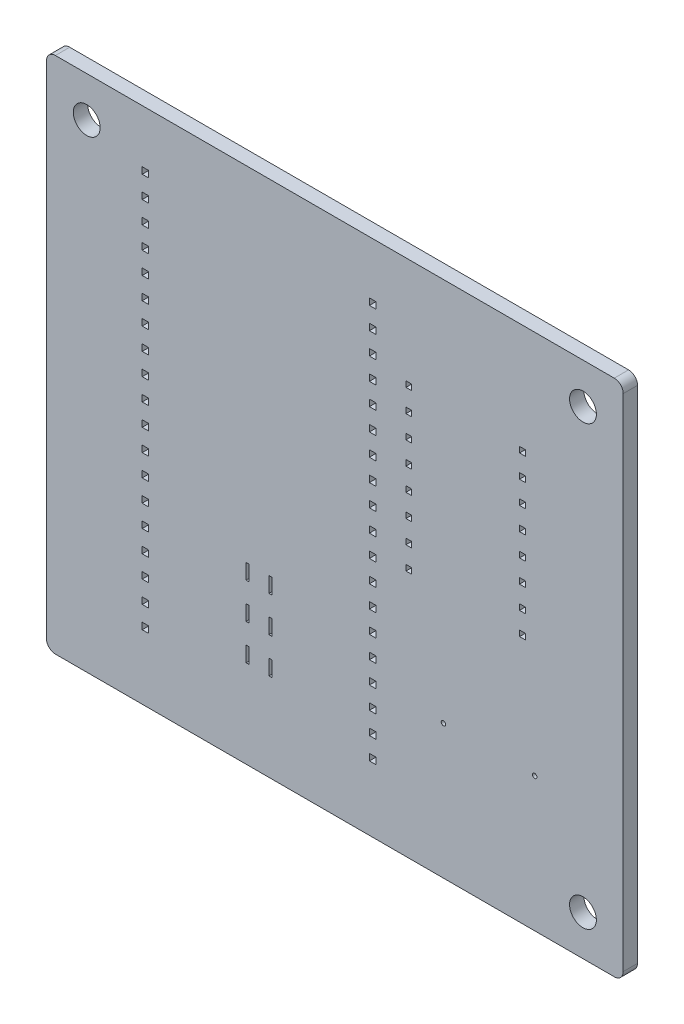
from build123d import *

# Parameters (mm, degrees)
SKETCH1_W            = 64.479999999
SKETCH1_H            = 57.961153769
SKETCH1_R            = 1.5
BOSS_EXTRUDE1_DEPTH  = 1.6
CAVITY1_START        = -42.506514758
CAVITY1_OUTLINE_W    = 0.72999995
CAVITY1_OUTLINE_H    = 1.6
CAVITY1_DEPTH        = 0.729999998
CAVITY1_START_2      = -17.106514758
CAVITY1_2_OUTLINE_W  = 0.72999995
CAVITY1_2_OUTLINE_H  = 1.6
CAVITY1_2_DEPTH      = 0.729999998
CAVITY1_START_3      = -13.02
CAVITY1_3_OUTLINE_W  = 0.64
CAVITY1_3_OUTLINE_H  = 1.6
CAVITY1_3_DEPTH      = 0.64
CAVITY1_START_4      = -0.32
CAVITY1_4_OUTLINE_W  = 0.64
CAVITY1_4_OUTLINE_H  = 1.6
CAVITY1_4_DEPTH      = 0.64
CAVITY1_START_5      = -30.889999853
CAVITY1_5_DEPTH      = 0.35
CAVITY1_START_6      = -28.339999853
CAVITY1_6_DEPTH      = 0.35
CAVITY1_START_7      = 6.554528938
CAVITY1_7_DEPTH      = 1.05
CAVITY1_START_8      = 18.954528938
CAVITY1_8_DEPTH      = 1.05
CAVITY1_START_9      = 7.604528938
CAVITY1_9_OUTLINE_W  = 0.4
CAVITY1_9_OUTLINE_H  = 0.05
CAVITY1_9_DEPTH      = 1
CAVITY1_START_10     = 17.954528938
CAVITY1_10_OUTLINE_W = 0.4
CAVITY1_10_OUTLINE_H = 0.05
CAVITY1_10_DEPTH     = 1
CAVITY1_11_OUTLINE_R = 0.25
CAVITY1_11_DEPTH     = 1.6
FILLET1_R            = 1


# Read off the part's stored shape, not the designer's step: Cavity1
with BuildPart() as part:
    # Sketch1 → Boss-Extrude1 (new body)
    with BuildSketch(Plane.XY):
        with Locations((-20.97, 1.019423116)):
            Rectangle(SKETCH1_W, SKETCH1_H)
        with Locations((-48.709999999, 25.5)):
            Circle(SKETCH1_R, mode=Mode.SUBTRACT)
        with Locations((6.77, 25.5)):
            Circle(SKETCH1_R, mode=Mode.SUBTRACT)
        with Locations((6.77, -23.461153769)):
            Circle(SKETCH1_R, mode=Mode.SUBTRACT)
    extrude(amount=BOSS_EXTRUDE1_DEPTH)

    # Cavity1 outline → Cavity1 (cut)
    with BuildSketch(Plane.YZ.offset(CAVITY1_START)):
        Polygon((2.032070031, 1.6), (1.302070031, 1.6), (1.302069981, 0), (2.032070031, 0), align=None)
        Polygon((-0.417930019, 0), (-0.417930019, 1.6), (-1.147929969, 1.6), (-1.147930019, 0), align=None)
        Polygon((-2.867930019, 0), (-2.867930019, 1.6), (-3.597929969, 1.6), (-3.597930019, 0), align=None)
        Polygon((4.482070031, 1.6), (3.752070031, 1.6), (3.752069981, 0), (4.482070031, 0), align=None)
        Polygon((-5.317930019, 0), (-5.317930019, 1.6), (-6.047929969, 1.6), (-6.047930019, 0), align=None)
        Polygon((-7.767930019, 0), (-7.767930019, 1.6), (-8.497929969, 1.6), (-8.497930019, 0), align=None)
        Polygon((6.932070031, 1.6), (6.202070031, 1.6), (6.202069981, 0), (6.932070031, 0), align=None)
        Polygon((-10.217929969, 0), (-10.217929969, 1.6), (-10.947929969, 1.6), (-10.947930019, 0), align=None)
        Polygon((9.382070031, 1.6), (8.652070031, 1.6), (8.652069981, 0), (9.382070031, 0), align=None)
        Polygon((-12.667930019, 0), (-12.667930019, 1.6), (-13.397929969, 1.6), (-13.397930019, 0), align=None)
        Polygon((11.832070031, 1.6), (11.102070031, 1.6), (11.102069981, 0), (11.832070031, 0), align=None)
        Polygon((-15.117930019, 0), (-15.117930019, 1.6), (-15.847929969, 1.6), (-15.847930019, 0), align=None)
        with Locations((-17.932929994, 0.8)):
            Rectangle(CAVITY1_OUTLINE_W, CAVITY1_OUTLINE_H)
        Polygon((14.282070031, 1.6), (13.552070031, 1.6), (13.552069981, 0), (14.282070031, 0), align=None)
        Polygon((-20.017930019, 0), (-20.017930019, 1.6), (-20.747929969, 1.6), (-20.747930019, 0), align=None)
        Polygon((16.732070031, 1.6), (16.002070031, 1.6), (16.002069981, 0), (16.732070031, 0), align=None)
        Polygon((19.182070031, 1.6), (18.452070031, 1.6), (18.452069981, 0), (19.182070031, 0), align=None)
        Polygon((21.632070031, 1.6), (20.902070031, 1.6), (20.902069981, 0), (21.632070031, 0), align=None)
        Polygon((24.082070031, 1.6), (23.352070031, 1.6), (23.352069981, 0), (24.082070031, 0), align=None)
    extrude(amount=CAVITY1_DEPTH, mode=Mode.SUBTRACT)

    # Cavity1 2 outline → Cavity1 2 (cut)
    with BuildSketch(Plane.YZ.offset(CAVITY1_START_2)):
        Polygon((2.032070031, 1.6), (1.302070031, 1.6), (1.302069981, 0), (2.032070031, 0), align=None)
        Polygon((-0.417930019, 0), (-0.417930019, 1.6), (-1.147929969, 1.6), (-1.147930019, 0), align=None)
        Polygon((-2.867930019, 0), (-2.867930019, 1.6), (-3.597929969, 1.6), (-3.597930019, 0), align=None)
        Polygon((4.482070031, 1.6), (3.752070031, 1.6), (3.752069981, 0), (4.482070031, 0), align=None)
        Polygon((-5.317930019, 0), (-5.317930019, 1.6), (-6.047929969, 1.6), (-6.047930019, 0), align=None)
        Polygon((-7.767930019, 0), (-7.767930019, 1.6), (-8.497929969, 1.6), (-8.497930019, 0), align=None)
        Polygon((6.932070031, 1.6), (6.202070031, 1.6), (6.202069981, 0), (6.932070031, 0), align=None)
        Polygon((-10.217929969, 0), (-10.217929969, 1.6), (-10.947929969, 1.6), (-10.947930019, 0), align=None)
        Polygon((9.382070031, 1.6), (8.652070031, 1.6), (8.652069981, 0), (9.382070031, 0), align=None)
        Polygon((-12.667930019, 0), (-12.667930019, 1.6), (-13.397929969, 1.6), (-13.397930019, 0), align=None)
        Polygon((11.832070031, 1.6), (11.102070031, 1.6), (11.102069981, 0), (11.832070031, 0), align=None)
        Polygon((-15.117930019, 0), (-15.117930019, 1.6), (-15.847929969, 1.6), (-15.847930019, 0), align=None)
        with Locations((-17.932929994, 0.8)):
            Rectangle(CAVITY1_2_OUTLINE_W, CAVITY1_2_OUTLINE_H)
        Polygon((14.282070031, 1.6), (13.552070031, 1.6), (13.552069981, 0), (14.282070031, 0), align=None)
        Polygon((-20.017930019, 0), (-20.017930019, 1.6), (-20.747929969, 1.6), (-20.747930019, 0), align=None)
        Polygon((16.732070031, 1.6), (16.002070031, 1.6), (16.002069981, 0), (16.732070031, 0), align=None)
        Polygon((19.182070031, 1.6), (18.452070031, 1.6), (18.452069981, 0), (19.182070031, 0), align=None)
        Polygon((21.632070031, 1.6), (20.902070031, 1.6), (20.902069981, 0), (21.632070031, 0), align=None)
        Polygon((24.082070031, 1.6), (23.352070031, 1.6), (23.352069981, 0), (24.082070031, 0), align=None)
    extrude(amount=CAVITY1_2_DEPTH, mode=Mode.SUBTRACT)

    # Cavity1 3 outline → Cavity1 3 (cut)
    with BuildSketch(Plane.YZ.offset(CAVITY1_START_3)):
        with Locations((0, 0.8)):
            Rectangle(CAVITY1_3_OUTLINE_W, CAVITY1_3_OUTLINE_H)
        with Locations((2.54, 0.8)):
            Rectangle(CAVITY1_3_OUTLINE_W, CAVITY1_3_OUTLINE_H)
        with Locations((5.08, 0.8)):
            Rectangle(CAVITY1_3_OUTLINE_W, CAVITY1_3_OUTLINE_H)
        with Locations((7.62, 0.8)):
            Rectangle(CAVITY1_3_OUTLINE_W, CAVITY1_3_OUTLINE_H)
        with Locations((10.16, 0.8)):
            Rectangle(CAVITY1_3_OUTLINE_W, CAVITY1_3_OUTLINE_H)
        with Locations((12.7, 0.8)):
            Rectangle(CAVITY1_3_OUTLINE_W, CAVITY1_3_OUTLINE_H)
        with Locations((15.24, 0.8)):
            Rectangle(CAVITY1_3_OUTLINE_W, CAVITY1_3_OUTLINE_H)
        with Locations((17.78, 0.8)):
            Rectangle(CAVITY1_3_OUTLINE_W, CAVITY1_3_OUTLINE_H)
    extrude(amount=CAVITY1_3_DEPTH, mode=Mode.SUBTRACT)

    # Cavity1 4 outline → Cavity1 4 (cut)
    with BuildSketch(Plane.YZ.offset(CAVITY1_START_4)):
        with Locations((0, 0.8)):
            Rectangle(CAVITY1_4_OUTLINE_W, CAVITY1_4_OUTLINE_H)
        with Locations((2.54, 0.8)):
            Rectangle(CAVITY1_4_OUTLINE_W, CAVITY1_4_OUTLINE_H)
        with Locations((5.08, 0.8)):
            Rectangle(CAVITY1_4_OUTLINE_W, CAVITY1_4_OUTLINE_H)
        with Locations((7.62, 0.8)):
            Rectangle(CAVITY1_4_OUTLINE_W, CAVITY1_4_OUTLINE_H)
        with Locations((10.16, 0.8)):
            Rectangle(CAVITY1_4_OUTLINE_W, CAVITY1_4_OUTLINE_H)
        with Locations((12.7, 0.8)):
            Rectangle(CAVITY1_4_OUTLINE_W, CAVITY1_4_OUTLINE_H)
        with Locations((15.24, 0.8)):
            Rectangle(CAVITY1_4_OUTLINE_W, CAVITY1_4_OUTLINE_H)
        with Locations((17.78, 0.8)):
            Rectangle(CAVITY1_4_OUTLINE_W, CAVITY1_4_OUTLINE_H)
    extrude(amount=CAVITY1_4_DEPTH, mode=Mode.SUBTRACT)

    # Cavity1 5 outline → Cavity1 5 (cut)
    with BuildSketch(Plane.YZ.offset(CAVITY1_START_5)):
        with BuildLine():
            Line((-8.419529048, 0.84979992), (-8.419529049, 1.6))
            Line((-8.419529049, 1.6), (-10.139529054, 1.6))
            Line((-10.139529054, 1.6), (-10.13952905, 0.84979992))
            ThreePointArc((-10.13952905, 0.84979992), (-10.171584104, 0.727325431), (-10.259529054, 0.636258353))
            ThreePointArc((-10.259529054, 0.636258353), (-10.347473997, 0.545191277), (-10.37952905, 0.42271679))
            Line((-10.37952905, 0.42271679), (-10.379529049, 0))
            Line((-10.379529049, 0), (-8.179529054, 0))
            Line((-8.179529054, 0), (-8.17952905, 0.42271679))
            ThreePointArc((-8.17952905, 0.42271679), (-8.211584103, 0.545191277), (-8.29952905, 0.636258355))
            ThreePointArc((-8.29952905, 0.636258355), (-8.387473996, 0.727325433), (-8.419529048, 0.84979992))
        make_face()
        with BuildLine():
            Line((-12.419529048, 0.84979992), (-12.419529049, 1.6))
            Line((-12.419529049, 1.6), (-14.139529054, 1.6))
            Line((-14.139529054, 1.6), (-14.13952905, 0.84979992))
            ThreePointArc((-14.13952905, 0.84979992), (-14.171584103, 0.727325433), (-14.25952905, 0.636258355))
            ThreePointArc((-14.25952905, 0.636258355), (-14.347473997, 0.545191277), (-14.37952905, 0.42271679))
            Line((-14.37952905, 0.42271679), (-14.379529049, 0))
            Line((-14.379529049, 0), (-12.179529054, 0))
            Line((-12.179529054, 0), (-12.17952905, 0.42271679))
            ThreePointArc((-12.17952905, 0.42271679), (-12.211584103, 0.545191277), (-12.29952905, 0.636258355))
            ThreePointArc((-12.29952905, 0.636258355), (-12.387473996, 0.727325433), (-12.419529048, 0.84979992))
        make_face()
        with BuildLine():
            Line((-16.419529048, 0.84979992), (-16.419529049, 1.6))
            Line((-16.419529049, 1.6), (-18.139529054, 1.6))
            Line((-18.139529054, 1.6), (-18.13952905, 0.84979992))
            ThreePointArc((-18.13952905, 0.84979992), (-18.171584103, 0.727325433), (-18.25952905, 0.636258355))
            ThreePointArc((-18.25952905, 0.636258355), (-18.347473998, 0.545191275), (-18.37952905, 0.42271679))
            Line((-18.37952905, 0.42271679), (-18.379529049, 0))
            Line((-18.379529049, 0), (-16.179529054, 0))
            Line((-16.179529054, 0), (-16.17952905, 0.42271679))
            ThreePointArc((-16.17952905, 0.42271679), (-16.211584103, 0.545191277), (-16.29952905, 0.636258355))
            ThreePointArc((-16.29952905, 0.636258355), (-16.387473996, 0.727325433), (-16.419529048, 0.84979992))
        make_face()
    extrude(amount=CAVITY1_5_DEPTH, mode=Mode.SUBTRACT)

    # Cavity1 6 outline → Cavity1 6 (cut)
    with BuildSketch(Plane.YZ.offset(CAVITY1_START_6)):
        with BuildLine():
            Line((-8.419529048, 0.84979992), (-8.419529049, 1.6))
            Line((-8.419529049, 1.6), (-10.139529054, 1.6))
            Line((-10.139529054, 1.6), (-10.13952905, 0.84979992))
            ThreePointArc((-10.13952905, 0.84979992), (-10.171584104, 0.727325431), (-10.259529054, 0.636258353))
            ThreePointArc((-10.259529054, 0.636258353), (-10.347473997, 0.545191277), (-10.37952905, 0.42271679))
            Line((-10.37952905, 0.42271679), (-10.379529049, 0))
            Line((-10.379529049, 0), (-8.179529054, 0))
            Line((-8.179529054, 0), (-8.17952905, 0.42271679))
            ThreePointArc((-8.17952905, 0.42271679), (-8.211584103, 0.545191277), (-8.29952905, 0.636258355))
            ThreePointArc((-8.29952905, 0.636258355), (-8.387473996, 0.727325433), (-8.419529048, 0.84979992))
        make_face()
        with BuildLine():
            Line((-12.419529048, 0.84979992), (-12.419529049, 1.6))
            Line((-12.419529049, 1.6), (-14.139529054, 1.6))
            Line((-14.139529054, 1.6), (-14.13952905, 0.84979992))
            ThreePointArc((-14.13952905, 0.84979992), (-14.171584103, 0.727325433), (-14.25952905, 0.636258355))
            ThreePointArc((-14.25952905, 0.636258355), (-14.347473997, 0.545191277), (-14.37952905, 0.42271679))
            Line((-14.37952905, 0.42271679), (-14.379529049, 0))
            Line((-14.379529049, 0), (-12.179529054, 0))
            Line((-12.179529054, 0), (-12.17952905, 0.42271679))
            ThreePointArc((-12.17952905, 0.42271679), (-12.211584103, 0.545191277), (-12.29952905, 0.636258355))
            ThreePointArc((-12.29952905, 0.636258355), (-12.387473996, 0.727325433), (-12.419529048, 0.84979992))
        make_face()
        with BuildLine():
            Line((-16.419529048, 0.84979992), (-16.419529049, 1.6))
            Line((-16.419529049, 1.6), (-18.139529054, 1.6))
            Line((-18.139529054, 1.6), (-18.13952905, 0.84979992))
            ThreePointArc((-18.13952905, 0.84979992), (-18.171584103, 0.727325433), (-18.25952905, 0.636258355))
            ThreePointArc((-18.25952905, 0.636258355), (-18.347473998, 0.545191275), (-18.37952905, 0.42271679))
            Line((-18.37952905, 0.42271679), (-18.379529049, 0))
            Line((-18.379529049, 0), (-16.179529054, 0))
            Line((-16.179529054, 0), (-16.17952905, 0.42271679))
            ThreePointArc((-16.17952905, 0.42271679), (-16.211584103, 0.545191277), (-16.29952905, 0.636258355))
            ThreePointArc((-16.29952905, 0.636258355), (-16.387473996, 0.727325433), (-16.419529048, 0.84979992))
        make_face()
    extrude(amount=CAVITY1_6_DEPTH, mode=Mode.SUBTRACT)

    # Cavity1 7 outline → Cavity1 7 (cut)
    with BuildSketch(Plane(origin=(0, 0, 0), x_dir=(1.0, 3.96254363179303e-09, 0), z_dir=(3.96254363179303e-09, -1.0, 0)).offset(CAVITY1_START_7)):
        with BuildLine():
            Line((-26.189999886, 0), (-25.789999886, 0))
            Line((-25.789999886, 0), (-25.789999886, 0.114360148))
            ThreePointArc((-25.789999886, 0.114360148), (-25.883582109, 0.371475191), (-26.120540615, 0.508283249))
            Line((-26.120540615, 0.508283249), (-27.562653841, 0.76256672))
            Line((-27.562653841, 0.76256672), (-27.632113112, 0.368643619))
            Line((-27.632113112, 0.368643619), (-26.242886403, 0.123685467))
            ThreePointArc((-26.242886403, 0.123685467), (-26.204973042, 0.101796178), (-26.189999886, 0.060657771))
            Line((-26.189999886, 0.060657771), (-26.189999886, 0))
        make_face()
        with BuildLine():
            ThreePointArc((-32.759459157, 0.508283249), (-32.996417663, 0.371475191), (-33.089999886, 0.114360148))
            Line((-33.089999886, 0.114360148), (-33.089999886, 0))
            Line((-33.089999886, 0), (-32.689999886, 0))
            Line((-32.689999886, 0), (-32.689999886, 0.060657771))
            ThreePointArc((-32.689999886, 0.060657771), (-32.67502673, 0.101796178), (-32.637113369, 0.123685467))
            Line((-32.637113369, 0.123685467), (-31.247886659, 0.368643619))
            Line((-31.247886659, 0.368643619), (-31.31734593, 0.76256672))
            Line((-31.31734593, 0.76256672), (-32.759459157, 0.508283249))
        make_face()
    extrude(amount=CAVITY1_7_DEPTH, mode=Mode.SUBTRACT)

    # Cavity1 8 outline → Cavity1 8 (cut)
    with BuildSketch(Plane(origin=(0, 0, 0), x_dir=(1.0, 3.96254363179303e-09, 0), z_dir=(3.96254363179303e-09, -1.0, 0)).offset(CAVITY1_START_8)):
        with BuildLine():
            Line((-26.189999886, 0), (-25.789999886, 0))
            Line((-25.789999886, 0), (-25.789999886, 0.114360148))
            ThreePointArc((-25.789999886, 0.114360148), (-25.883582109, 0.371475191), (-26.120540615, 0.508283249))
            Line((-26.120540615, 0.508283249), (-27.562653841, 0.76256672))
            Line((-27.562653841, 0.76256672), (-27.632113112, 0.368643619))
            Line((-27.632113112, 0.368643619), (-26.242886403, 0.123685467))
            ThreePointArc((-26.242886403, 0.123685467), (-26.204973042, 0.101796178), (-26.189999886, 0.060657771))
            Line((-26.189999886, 0.060657771), (-26.189999886, 0))
        make_face()
        with BuildLine():
            ThreePointArc((-32.759459157, 0.508283249), (-32.996417663, 0.371475191), (-33.089999886, 0.114360148))
            Line((-33.089999886, 0.114360148), (-33.089999886, 0))
            Line((-33.089999886, 0), (-32.689999886, 0))
            Line((-32.689999886, 0), (-32.689999886, 0.060657771))
            ThreePointArc((-32.689999886, 0.060657771), (-32.67502673, 0.101796178), (-32.637113369, 0.123685467))
            Line((-32.637113369, 0.123685467), (-31.247886659, 0.368643619))
            Line((-31.247886659, 0.368643619), (-31.31734593, 0.76256672))
            Line((-31.31734593, 0.76256672), (-32.759459157, 0.508283249))
        make_face()
    extrude(amount=CAVITY1_8_DEPTH, mode=Mode.SUBTRACT)

    # Cavity1 9 outline → Cavity1 9 (cut)
    with BuildSketch(Plane(origin=(0, 0, 0), x_dir=(1.0, 3.96254363179303e-09, 0), z_dir=(3.96254363179303e-09, -1.0, 0)).offset(CAVITY1_START_9)):
        with Locations((-25.989999886, 0.025)):
            Rectangle(CAVITY1_9_OUTLINE_W, CAVITY1_9_OUTLINE_H)
        with Locations((-32.889999886, 0.025)):
            Rectangle(CAVITY1_9_OUTLINE_W, CAVITY1_9_OUTLINE_H)
    extrude(amount=CAVITY1_9_DEPTH, mode=Mode.SUBTRACT)

    # Cavity1 10 outline → Cavity1 10 (cut)
    with BuildSketch(Plane(origin=(0, 0, 0), x_dir=(1.0, 3.96254363179303e-09, 0), z_dir=(3.96254363179303e-09, -1.0, 0)).offset(CAVITY1_START_10)):
        with Locations((-25.989999886, 0.025)):
            Rectangle(CAVITY1_10_OUTLINE_W, CAVITY1_10_OUTLINE_H)
        with Locations((-32.889999886, 0.025)):
            Rectangle(CAVITY1_10_OUTLINE_W, CAVITY1_10_OUTLINE_H)
    extrude(amount=CAVITY1_10_DEPTH, mode=Mode.SUBTRACT)

    # Cavity1 11 outline → Cavity1 11 (cut)
    with BuildSketch(Plane.XY):
        with Locations((1.37, -12.961153769)):
            Circle(CAVITY1_11_OUTLINE_R)
        with Locations((-8.83, -12.961153769)):
            Circle(CAVITY1_11_OUTLINE_R)
    extrude(amount=CAVITY1_11_DEPTH, mode=Mode.SUBTRACT)

    # Fillet1
    fillet1_edges = [part.edges().sort_by_distance(p)[0] for p in [
        (-53.209999999, 30, 0.8),
        (11.27, 30, 0.8),
        (11.27, -27.961153769, 0.8),
        (-53.209999999, -27.961153769, 0.8),
    ]]
    fillet(fillet1_edges, radius=FILLET1_R)


solid = part.part
